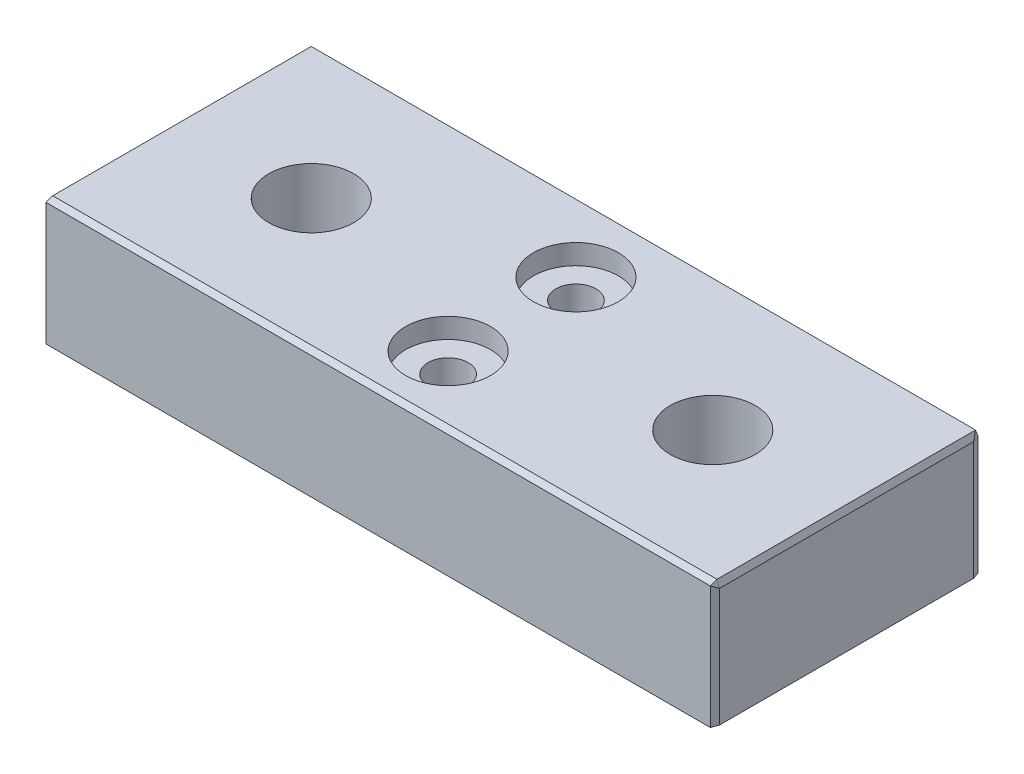
from build123d import *

# Parameters (mm, degrees)
SKETCH3_W           = 100
SKETCH3_H           = 40
BOSS_EXTRUDE1_DEPTH = 19.05
SKETCH4_R           = 3
SKETCH4_R_2         = 6.35
CUT_EXTRUDE1_DEPTH  = 58.121821575
SKETCH5_R           = 6.35
CUT_EXTRUDE2_DEPTH  = 3


with BuildPart() as part:
    # Sketch3 → Boss-Extrude1 (new body)
    with BuildSketch(Plane(origin=(0, 0, 0), x_dir=(1, 0, 0), z_dir=(0, 1, 0))):
        Rectangle(SKETCH3_W, SKETCH3_H)
    extrude(amount=BOSS_EXTRUDE1_DEPTH)

    # Sketch4 → Cut-Extrude1 (cut, through all)
    with BuildSketch(Plane(origin=(0, 19.05, 0), x_dir=(1, 0, 0), z_dir=(0, 1, 0))):
        with Locations(Location((0, 9.55, 0), (0, 0, 270))):
            Circle(SKETCH4_R)
        with Locations(Location((0, -9.55, 0), (0, 0, 270))):
            Circle(SKETCH4_R)
        with Locations(Location((-30, 0, 0), (0, 0, 270))):
            Circle(SKETCH4_R_2)
        with Locations(Location((30, 0, 0), (0, 0, 270))):
            Circle(SKETCH4_R_2)
    extrude(amount=-CUT_EXTRUDE1_DEPTH, mode=Mode.SUBTRACT)

    # Sketch5 → Cut-Extrude2 (cut)
    with BuildSketch(Plane(origin=(0, 19.05, 0), x_dir=(1, 0, 0), z_dir=(0, 1, 0))):
        with Locations(Location((0, 9.55, 0), (0, 0, 270))):
            Circle(SKETCH5_R)
        with Locations(Location((0, -9.55, 0), (0, 0, 270))):
            Circle(SKETCH5_R)
    extrude(amount=-CUT_EXTRUDE2_DEPTH, mode=Mode.SUBTRACT)

    # Chamfer1
    # the kernel refuses this chamfer: 1, 0.363970234 mm, written as the material it takes off along each edge
    with BuildSketch(Plane(origin=(-49.757353177, 18.595343255, 19.333333333), x_dir=(0.34202014332567077, 0.9396926207859077, 0), z_dir=(-0.932495167133386, 0.3394004844336423, 0.12353167382937617))) as chamfer1_piece_1:
        Polygon((-0.595445134, 0.335906163), (0.468732639, 0.335906163), (0.126712495, -0.671812326), align=None)
    extrude(amount=0.509225374, mode=Mode.SUBTRACT)
    with BuildSketch(Plane(origin=(-49.545343255, 18.383333333, -19.757353177), x_dir=(-0.9396926207859077, 0, 0.34202014332567077), z_dir=(-0.3394004844336423, 0.12353167382937617, -0.932495167133386)), Plane(origin=(49.757353177, 18.595343255, 19.333333333), x_dir=(-0.34202014332567077, 0.9396926207859077, 0), z_dir=(0.932495167133386, 0.3394004844336423, 0.12353167382937617)), Plane(origin=(49.545343255, 0.242646823, -19.333333333), x_dir=(0.34202014332567077, 0, 0.9396926207859077), z_dir=(0.3394004844336414, -0.9324951671333863, -0.12353167382937585))) as chamfer1_piece_2:
        Polygon((-0.595445134, -0.335906163), (0.468732639, -0.335906163), (0.126712495, 0.671812326), align=None)
    extrude(amount=0.509225374, mode=Mode.SUBTRACT)
    with BuildSketch(Plane(origin=(-49.545343255, 0.242646823, 19.333333333), x_dir=(0.9396926207859081, -0.3420201433256699, 0), z_dir=(-0.3394004844336414, -0.9324951671333863, 0.12353167382937585))) as chamfer1_piece_3:
        Polygon((-0.468732639, -0.335906163), (0.595445134, -0.335906163), (-0.126712495, 0.671812326), align=None)
    extrude(amount=0.509225374, mode=Mode.SUBTRACT)
    with BuildSketch(Plane(origin=(49.757353177, 18.383333333, -19.545343255), x_dir=(0.34202014332567077, 0, 0.9396926207859077), z_dir=(0.932495167133386, 0.12353167382937617, -0.3394004844336423)), Plane(origin=(49.545343255, 0.242646823, 19.333333333), x_dir=(-0.9396926207859081, -0.3420201433256699, 0), z_dir=(0.3394004844336414, -0.9324951671333863, 0.12353167382937585)), Plane(origin=(-49.333333333, 0.242646823, -19.545343255), x_dir=(-0.9396926207859077, 0, 0.34202014332567077), z_dir=(-0.12353167382937585, -0.9324951671333863, -0.3394004844336414))) as chamfer1_piece_4:
        Polygon((-0.468732639, 0.335906163), (0.595445134, 0.335906163), (-0.126712495, -0.671812326), align=None)
    extrude(amount=0.509225374, mode=Mode.SUBTRACT)
    with BuildSketch(Plane(origin=(-50, 19.05, 22.594194733), x_dir=(-0.013184058198643421, -0.9999130865277317, 0), z_dir=(0, 0, -1)), Plane(origin=(50, 19.05, -22.594194733), x_dir=(0.013184058198643421, -0.9999130865277317, 0), z_dir=(0, 0, 1))) as chamfer1_piece_5:
        with BuildLine():
            Line((1.037677893, 0), (-0.042563411, -0.377122659))
            Line((-0.042563411, -0.377122659), (-0.062561673, -0.376858977))
            ThreePointArc((-0.062561673, -0.376858977), (-0.022487748, -0.188545427), (-0.019998262, 0.000263681))
            Line((-0.019998262, 0.000263681), (0.000263681, 0.019998262))
            ThreePointArc((0.000263681, 0.019998262), (0.519012443, 0.013158453), (1.037941574, 0.019998262))
            Line((1.037941574, 0.019998262), (1.037677893, 0))
        make_face()
    extrude(amount=45.188389465, mode=Mode.SUBTRACT)
    with BuildSketch(Plane(origin=(-50, -2.594194733, 20), x_dir=(-0.013184058198643421, 0, -0.9999130865277317), z_dir=(0, 1, 0)), Plane(origin=(-50, -2.594194733, -20), x_dir=(0.9999130865277315, 0, -0.013184058198646842), z_dir=(0, 1, 0))) as chamfer1_piece_6:
        with BuildLine():
            Line((1.037677893, 0), (-0.042563411, -0.377122659))
            Line((-0.042563411, -0.377122659), (-0.062561673, -0.376858977))
            ThreePointArc((-0.062561673, -0.376858977), (-0.022487748, -0.188545427), (-0.019998262, 0.000263681))
            Line((-0.019998262, 0.000263681), (0.000263681, 0.019998262))
            ThreePointArc((0.000263681, 0.019998262), (0.519012443, 0.013158453), (1.037941574, 0.019998262))
            Line((1.037941574, 0.019998262), (1.037677893, 0))
        make_face()
    extrude(amount=24.238389465, mode=Mode.SUBTRACT)
    with BuildSketch(Plane(origin=(52.594194733, 19.05, 20), x_dir=(0, 0.013184058198646846, -0.9999130865277317), z_dir=(-1, 0, 0))) as chamfer1_piece_7:
        with BuildLine():
            Line((1.037677893, 0), (-0.042563411, 0.377122659))
            Line((-0.042563411, 0.377122659), (-0.062561673, 0.376858977))
            ThreePointArc((-0.062561673, 0.376858977), (-0.022487748, 0.188545427), (-0.019998262, -0.000263681))
            Line((-0.019998262, -0.000263681), (0.000263681, -0.019998262))
            ThreePointArc((0.000263681, -0.019998262), (0.519012443, -0.013158453), (1.037941574, -0.019998262))
            Line((1.037941574, -0.019998262), (1.037677893, 0))
        make_face()
    extrude(amount=105.188389465, mode=Mode.SUBTRACT)
    with BuildSketch(Plane(origin=(50, -2.594194733, 20), x_dir=(0.013184058198643421, 0, -0.9999130865277317), z_dir=(0, 1, 0))) as chamfer1_piece_8:
        with BuildLine():
            Line((1.037677893, 0), (-0.042563411, 0.377122659))
            Line((-0.042563411, 0.377122659), (-0.062561673, 0.376858977))
            ThreePointArc((-0.062561673, 0.376858977), (-0.022487748, 0.188545427), (-0.019998262, -0.000263681))
            Line((-0.019998262, -0.000263681), (0.000263681, -0.019998262))
            ThreePointArc((0.000263681, -0.019998262), (0.519012443, -0.013158453), (1.037941574, -0.019998262))
            Line((1.037941574, -0.019998262), (1.037677893, 0))
        make_face()
    extrude(amount=24.238389465, mode=Mode.SUBTRACT)
    with BuildSketch(Plane(origin=(50, -2.594194733, -20), x_dir=(-0.9950833631817483, 0, -0.09904090225205378), z_dir=(0, 1, 0))) as chamfer1_piece_9:
        with BuildLine():
            Line((0.379516987, 0), (-0.116377165, 1.031131304))
            Line((-0.116377165, 1.031131304), (-0.136278832, 1.029150486))
            ThreePointArc((-0.136278832, 1.029150486), (-0.071283478, 0.514262313), (-0.019901667, -0.001980818))
            Line((-0.019901667, -0.001980818), (0.001980818, -0.019901667))
            ThreePointArc((0.001980818, -0.019901667), (0.189877952, -0.001200217), (0.381497805, -0.019901667))
            Line((0.381497805, -0.019901667), (0.379516987, 0))
        make_face()
    extrude(amount=24.238389465, mode=Mode.SUBTRACT)
    with BuildSketch(Plane(origin=(52.594194733, 0, 20), x_dir=(0, -0.013184058198645909, -0.9999130865277317), z_dir=(-1, 0, 0)), Plane(origin=(-52.594194733, 19.05, -20), x_dir=(0, -0.9999130865277315, -0.013184058198646842), z_dir=(1, 0, 0))) as chamfer1_piece_10:
        with BuildLine():
            Line((1.037677893, 0), (-0.042563411, -0.377122659))
            Line((-0.042563411, -0.377122659), (-0.062561673, -0.376858977))
            ThreePointArc((-0.062561673, -0.376858977), (-0.022487748, -0.188545427), (-0.019998262, 0.000263681))
            Line((-0.019998262, 0.000263681), (0.000263681, 0.019998262))
            ThreePointArc((0.000263681, 0.019998262), (0.519012443, 0.013158453), (1.037941574, 0.019998262))
            Line((1.037941574, 0.019998262), (1.037677893, 0))
        make_face()
    extrude(amount=105.188389465, mode=Mode.SUBTRACT)
    with BuildSketch(Plane(origin=(-50, 0, 22.594194733), x_dir=(-0.0990409022520534, 0.9950833631817484, 0), z_dir=(0, 0, -1)), Plane(origin=(50, 0, -22.594194733), x_dir=(0.0990409022520534, 0.9950833631817484, 0), z_dir=(0, 0, 1))) as chamfer1_piece_11:
        with BuildLine():
            Line((0.379516987, 0), (-0.116377165, 1.031131304))
            Line((-0.116377165, 1.031131304), (-0.136278832, 1.029150486))
            ThreePointArc((-0.136278832, 1.029150486), (-0.071283478, 0.514262313), (-0.019901667, -0.001980818))
            Line((-0.019901667, -0.001980818), (0.001980818, -0.019901667))
            ThreePointArc((0.001980818, -0.019901667), (0.189877952, -0.001200217), (0.381497805, -0.019901667))
            Line((0.381497805, -0.019901667), (0.379516987, 0))
        make_face()
    extrude(amount=45.188389465, mode=Mode.SUBTRACT)
    with BuildSketch(Plane(origin=(-52.594194733, 0, -20), x_dir=(0, 0.9950833631817482, -0.09904090225205339), z_dir=(1, 0, 0))) as chamfer1_piece_12:
        with BuildLine():
            Line((0.379516987, 0), (-0.116377165, 1.031131304))
            Line((-0.116377165, 1.031131304), (-0.136278832, 1.029150486))
            ThreePointArc((-0.136278832, 1.029150486), (-0.071283478, 0.514262313), (-0.019901667, -0.001980818))
            Line((-0.019901667, -0.001980818), (0.001980818, -0.019901667))
            ThreePointArc((0.001980818, -0.019901667), (0.189877952, -0.001200217), (0.381497805, -0.019901667))
            Line((0.381497805, -0.019901667), (0.379516987, 0))
        make_face()
    extrude(amount=105.188389465, mode=Mode.SUBTRACT)


solid = part.part
